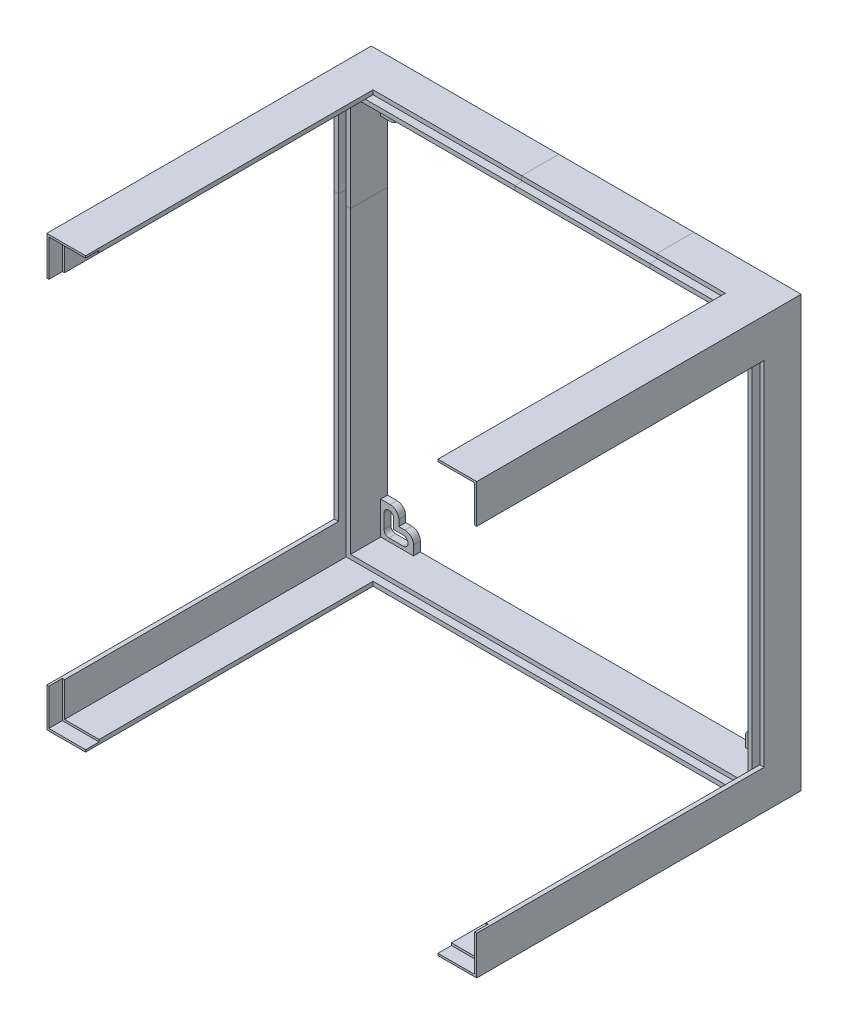
from build123d import *

# Parameters (mm, degrees)
BOSS_EXTRUDE3_DEPTH      = 6.35
BOSS_EXTRUDE3_2_DEPTH    = 6.35
BOSS_EXTRUDE3_3_DEPTH    = 6.35
BOSS_EXTRUDE3_4_DEPTH    = 6.35
BOSS_EXTRUDE10_DEPTH     = 5.08
SKETCH1_8_W              = 260.964039546
SKETCH1_8_H              = 3.175
SKETCH1_8_W_2            = 3.175
SKETCH1_8_H_2            = 260.964039546
BOSS_EXTRUDE4_DEPTH      = 27.44
BOSS_EXTRUDE6_DEPTH      = 240.35
SKETCH1_13_W             = 5.715
SKETCH1_13_H             = 260.964039546
SKETCH1_13_W_2           = 260.964039546
SKETCH1_13_H_2           = 5.715
BOSS_EXTRUDE9_DEPTH      = 6.35
CUT_EXTRUDE1_DEPTH       = 10
FILLET1_R                = 2.54
FILLET2_R                = 6.35
CIRPATTERN4_COUNT        = 4
FILLET2_OF_CIRPATTERN4_R = 6.35
SPLIT1_START             = 233.89375
SPLIT1_DEPTH             = 84.55875
SPLIT1_START_2           = 238.89375
SPLIT1_2_DEPTH           = 79.55875
SPLIT1_START_3           = 315.2775
SPLIT1_3_DEPTH           = 3.175
SPLIT1_START_4           = 223.99375
SPLIT1_4_OUTLINE_W       = 5.515
SPLIT1_4_OUTLINE_H       = 6.35
SPLIT1_4_OUTLINE_W_2     = 10
SPLIT1_4_DEPTH           = 85.56875
SPLIT1_5_DEPTH           = 230.35
SPLIT1_6_OUTLINE_W       = 3.175
SPLIT1_6_OUTLINE_H       = 50.814519773
SPLIT1_6_OUTLINE_W_2     = 110.149519773
SPLIT1_6_OUTLINE_H_2     = 3.175
SPLIT1_6_DEPTH           = 27.44
SPLIT1_7_DEPTH           = 6.35
SPLIT1_8_DEPTH           = 5.08
SPLIT1_START_5           = 230.35
SPLIT1_9_DEPTH           = 10
SPLIT1_START_6           = 138.89375
SPLIT1_10_DEPTH          = 85
SPLIT1_START_7           = 223.89375
SPLIT1_11_OUTLINE_W      = 3.175
SPLIT1_11_OUTLINE_H      = 27.44
SPLIT1_11_DEPTH          = 10
SPLIT1_START_8           = 133.89375
SPLIT1_12_DEPTH          = 5
SPLIT1_13_OUTLINE_W      = 3.175
SPLIT1_13_OUTLINE_H      = 27.44
SPLIT1_13_DEPTH          = 5
SPLIT1_START_9           = 123.99375
SPLIT1_14_OUTLINE_W      = 5.515
SPLIT1_14_OUTLINE_H      = 6.35
SPLIT1_14_DEPTH          = 9.9
SPLIT1_START_10          = 315.1775
SPLIT1_15_OUTLINE_W      = 15
SPLIT1_15_OUTLINE_H      = 6.35
SPLIT1_15_DEPTH          = 0.1
SPLIT1_START_11          = 309.5625
SPLIT1_16_OUTLINE_W      = 10
SPLIT1_16_OUTLINE_H      = 6.35
SPLIT1_16_DEPTH          = 0.1
SPLIT1_START_12          = 309.6625
SPLIT1_17_OUTLINE_W      = 0.1
SPLIT1_17_OUTLINE_H      = 6.35
SPLIT1_17_DEPTH          = 5.515


# Read off the part's stored shape, not the designer's step: Split1
with BuildPart() as part:
    # Sketch1 → Boss-Extrude3 (new body)
    with BuildSketch(Plane.XY):
        Polygon((3.175, 289.708269773), (8.89, 289.708269773), (8.89, 309.5625), (28.744230227, 309.5625), (28.744230227, 315.2775), (3.175, 315.2775), align=None)
    extrude(amount=BOSS_EXTRUDE3_DEPTH)


with BuildPart() as body_2:
    # Sketch1 → Boss-Extrude3 2 (new body)
    with BuildSketch(Plane.XY):
        Polygon((8.89, 8.89), (8.89, 28.744230227), (3.175, 28.744230227), (3.175, 3.175), (28.744230227, 3.175), (28.744230227, 8.89), align=None)
    extrude(amount=BOSS_EXTRUDE3_2_DEPTH)

    # Sketch1<8> → Boss-Extrude4 (add)
    with BuildSketch(Plane.XY):
        Polygon((28.744230227, 309.5625), (28.744230227, 306.3875), (36.364230227, 306.3875), (289.708269773, 306.3875), (289.708269773, 309.5625), align=None)
        Polygon((12.065, 282.088269773), (12.065, 289.708269773), (8.89, 289.708269773), (8.89, 28.744230227), (12.065, 28.744230227), align=None)
        with Locations((159.22625, 10.4775)):
            Rectangle(SKETCH1_8_W, SKETCH1_8_H)
        with Locations((307.975, 159.22625)):
            Rectangle(SKETCH1_8_W_2, SKETCH1_8_H_2)
        Polygon((8.89, 289.708269773), (12.065, 289.708269773), (12.065, 306.3875), (28.744230227, 306.3875), (28.744230227, 309.5625), (8.89, 309.5625), align=None)
        Polygon((289.708269773, 309.5625), (289.708269773, 306.3875), (306.3875, 306.3875), (306.3875, 289.708269773), (309.5625, 289.708269773), (309.5625, 309.5625), align=None)
        Polygon((306.3875, 12.065), (289.708269773, 12.065), (289.708269773, 8.89), (309.5625, 8.89), (309.5625, 28.744230227), (306.3875, 28.744230227), align=None)
        Polygon((12.065, 12.065), (12.065, 28.744230227), (8.89, 28.744230227), (8.89, 8.89), (28.744230227, 8.89), (28.744230227, 12.065), align=None)
        with Locations((1.5875, 159.22625)):
            Rectangle(SKETCH1_8_W_2, SKETCH1_8_H_2)
        with Locations((159.22625, 1.5875)):
            Rectangle(SKETCH1_8_W, SKETCH1_8_H)
        with Locations((316.865, 159.22625)):
            Rectangle(SKETCH1_8_W_2, SKETCH1_8_H_2)
        with Locations((159.22625, 316.865)):
            Rectangle(SKETCH1_8_W, SKETCH1_8_H)
    extrude(amount=BOSS_EXTRUDE4_DEPTH)


with BuildPart() as body_3:
    # Sketch1 → Boss-Extrude3 3 (new body)
    with BuildSketch(Plane.XY):
        Polygon((289.708269773, 315.2775), (289.708269773, 309.5625), (309.5625, 309.5625), (309.5625, 289.708269773), (315.2775, 289.708269773), (315.2775, 315.2775), align=None)
    extrude(amount=BOSS_EXTRUDE3_3_DEPTH)


with BuildPart() as body_4:
    # Sketch1 → Boss-Extrude3 4 (new body)
    with BuildSketch(Plane.XY):
        Polygon((309.5625, 8.89), (289.708269773, 8.89), (289.708269773, 3.175), (315.2775, 3.175), (315.2775, 28.744230227), (309.5625, 28.744230227), align=None)
    extrude(amount=BOSS_EXTRUDE3_4_DEPTH)



with BuildPart() as body_5:
    # Sketch1<14> → Boss-Extrude10 (new body)
    with BuildSketch(Plane.XY):
        Polygon((12.065, 306.3875), (12.065, 289.708269773), (12.065, 282.088269773), (25.4635, 282.088269773), (25.4635, 292.989), (36.364230227, 292.989), (36.364230227, 306.3875), (28.744230227, 306.3875), align=None)
        with BuildLine():
            ThreePointArc((14.5415, 300.355), (14.812184382, 301.715822285), (15.583028286, 302.869471714))
            ThreePointArc((15.583028286, 302.869471714), (16.736677715, 303.640315618), (18.0975, 303.911))
            Line((18.0975, 303.911), (28.744230227, 303.911))
            ThreePointArc((28.744230227, 303.911), (32.300230227, 300.355), (28.744230227, 296.799))
            Line((28.744230227, 296.799), (21.6535, 296.799))
            Line((21.6535, 296.799), (21.6535, 289.708269773))
            ThreePointArc((21.6535, 289.708269773), (18.0975, 286.152269773), (14.5415, 289.708269773))
            Line((14.5415, 289.708269773), (14.5415, 300.355))
        make_face(mode=Mode.SUBTRACT)
    boss_extrude10 = extrude(amount=BOSS_EXTRUDE10_DEPTH)


with BuildPart() as boss_extrude4_piece_1:
    # of the separate pieces the step leaves, piece 1, a body of its own (boss_extrude4_pieces)
    add(body_2.part.solids().sort_by_distance((8.89, 28.744230227, 0))[0])


with BuildPart() as boss_extrude4_piece_2:
    # of the separate pieces the step leaves, piece 2, a body of its own (boss_extrude4_pieces)
    add(body_2.part.solids().sort_by_distance((28.744230227, 318.4525, 0))[0])


with BuildPart() as boss_extrude4_piece_3:
    # of the separate pieces the step leaves, piece 3, a body of its own (boss_extrude4_pieces)
    add(body_2.part.solids().sort_by_distance((318.4525, 289.708269773, 0))[0])


with BuildPart() as boss_extrude4_piece_4:
    # of the separate pieces the step leaves, piece 4, a body of its own (boss_extrude4_pieces)
    add(body_2.part.solids().sort_by_distance((289.708269773, 3.175, 0))[0])


with BuildPart() as boss_extrude4_piece_5:
    # of the separate pieces the step leaves, piece 5, a body of its own (boss_extrude4_pieces)
    add(body_2.part.solids().sort_by_distance((3.175, 28.744230227, 27.44))[0])


with BuildPart() as body_4_1:
    add(body_4.part)

    add(boss_extrude4_piece_1.part)  # Boss-Extrude6 merges Boss-Extrude4 piece 1

    add(body_3.part)  # Boss-Extrude6 merges body 3

    add(part.part)  # Boss-Extrude6 merges part

    add(body_5.part)  # Boss-Extrude6 merges body 5

    add(boss_extrude4_piece_4.part)  # Boss-Extrude6 merges Boss-Extrude4 piece 4

    add(boss_extrude4_piece_5.part)  # Boss-Extrude6 merges Boss-Extrude4 piece 5

    add(boss_extrude4_piece_3.part)  # Boss-Extrude6 merges Boss-Extrude4 piece 3

    add(boss_extrude4_piece_2.part)  # Boss-Extrude6 merges Boss-Extrude4 piece 2
    # Sketch1<10> → Boss-Extrude6 (add)
    with BuildSketch(Plane.XY):
        Polygon((3.175, 3.175), (3.175, 28.744230227), (0, 28.744230227), (0, 0), (28.744230227, 0), (28.744230227, 3.175), align=None)
        Polygon((315.2775, 3.175), (289.708269773, 3.175), (289.708269773, 0), (318.4525, 0), (318.4525, 28.744230227), (315.2775, 28.744230227), align=None)
        Polygon((0, 289.708269773), (3.175, 289.708269773), (3.175, 315.2775), (28.744230227, 315.2775), (28.744230227, 318.4525), (0, 318.4525), align=None)
        Polygon((289.708269773, 318.4525), (289.708269773, 315.2775), (315.2775, 315.2775), (315.2775, 289.708269773), (318.4525, 289.708269773), (318.4525, 318.4525), align=None)
    extrude(amount=BOSS_EXTRUDE6_DEPTH)

    # Sketch1<13> → Boss-Extrude9 (add)
    with BuildSketch(Plane.XY):
        with Locations((6.0325, 159.22625)):
            Rectangle(SKETCH1_13_W, SKETCH1_13_H)
        with Locations((159.22625, 312.42)):
            Rectangle(SKETCH1_13_W_2, SKETCH1_13_H_2)
        with Locations((312.42, 159.22625)):
            Rectangle(SKETCH1_13_W, SKETCH1_13_H)
        with Locations((159.22625, 6.0325)):
            Rectangle(SKETCH1_13_W_2, SKETCH1_13_H_2)
    extrude(amount=BOSS_EXTRUDE9_DEPTH)

    # Sketch7 → Cut-Extrude1 (cut)
    with BuildSketch(Plane.XY.offset(240.35)):
        Polygon((28.744230227, 315.2775), (28.744230227, 316.9525), (1.5875, 316.9525), (1.5875, 289.708269773), (3.175, 289.708269773), (3.175, 315.2775), align=None)
    cut_extrude1 = extrude(amount=-CUT_EXTRUDE1_DEPTH, mode=Mode.SUBTRACT)

    # Fillet1
    fillet1_edges = [body_4_1.edges().sort_by_distance(p)[0] for p in [
        (25.4635, 292.989, 2.54),
        (21.6535, 296.799, 2.54),
    ]]
    fillet(fillet1_edges, radius=FILLET1_R)

    # Fillet2
    fillet2_edges = [body_4_1.edges().sort_by_distance(p)[0] for p in [
        (25.4635, 282.088269773, 2.54),
        (36.364230227, 292.989, 2.54),
    ]]
    fillet(fillet2_edges, radius=FILLET2_R)

    # CirPattern4: Boss-Extrude10, Cut-Extrude1 ×4 about axis
    cirpattern4_axis = Axis((159.22625, 159.22625, 0), (0, 0, 1))
    add([boss_extrude10.rotate(cirpattern4_axis, i * 360 / CIRPATTERN4_COUNT) for i in range(1, CIRPATTERN4_COUNT)])
    add([cut_extrude1.rotate(cirpattern4_axis, i * 360 / CIRPATTERN4_COUNT) for i in range(1, CIRPATTERN4_COUNT)], mode=Mode.SUBTRACT)

    # Fillet2 of CirPattern4
    fillet2_of_cirpattern4_edges = [body_4_1.edges().sort_by_distance(p)[0] for p in [
        (36.364230227, 25.4635, 2.54),
        (25.4635, 36.364230227, 2.54),
        (292.989, 36.364230227, 2.54),
        (282.088269773, 25.4635, 2.54),
        (282.088269773, 292.989, 2.54),
        (292.989, 282.088269773, 2.54),
    ]]
    fillet(fillet2_of_cirpattern4_edges, radius=FILLET2_OF_CIRPATTERN4_R)

    # Split1 outline → Split1 (cut)
    with BuildSketch(Plane(origin=(0, 0, 0), x_dir=(1, 0, 0), z_dir=(0, 1, 0)).offset(SPLIT1_START)):
        Polygon((3.275, 0), (3.275, -6.35), (3.175, -6.35), (3.175, -27.44), (0, -27.44), (0, -240.35), (28.744230227, -240.35), (28.744230227, -27.44), (233.89375, -27.44), (233.89375, -6.35), (223.89375, -6.35), (223.89375, 0), align=None)
    extrude(amount=SPLIT1_DEPTH, mode=Mode.SUBTRACT)

    # Split1 2 outline → Split1 2 (cut)
    with BuildSketch(Plane(origin=(0, 0, 0), x_dir=(1, 0, 0), z_dir=(0, 1, 0)).offset(SPLIT1_START_2)):
        Polygon((3.275, -6.35), (3.275, 0), (0, 0), (0, -27.44), (3.175, -27.44), (3.175, -6.35), align=None)
    extrude(amount=SPLIT1_2_DEPTH, mode=Mode.SUBTRACT)

    # Split1 3 outline → Split1 3 (cut)
    with BuildSketch(Plane(origin=(0, 0, 0), x_dir=(1, 0, 0), z_dir=(0, 1, 0)).offset(SPLIT1_START_3)):
        Polygon((223.89375, 0), (223.89375, -6.35), (233.89375, -6.35), (233.89375, -27.44), (238.89375, -27.44), (238.89375, 0), align=None)
    extrude(amount=SPLIT1_3_DEPTH, mode=Mode.SUBTRACT)

    # Split1 4 outline → Split1 4 (cut)
    with BuildSketch(Plane(origin=(0, 0, 0), x_dir=(1, 0, 0), z_dir=(0, 1, 0)).offset(SPLIT1_START_4)):
        with Locations((6.0325, -3.175)):
            Rectangle(SPLIT1_4_OUTLINE_W, SPLIT1_4_OUTLINE_H)
        with Locations((228.89375, -3.175)):
            Rectangle(SPLIT1_4_OUTLINE_W_2, SPLIT1_4_OUTLINE_H)
    extrude(amount=SPLIT1_4_DEPTH, mode=Mode.SUBTRACT)


with BuildPart() as body_2_2:
    # Split1 5 outline → Split1 5 (new body)
    with BuildSketch(Plane.XY):
        Polygon((3.175, 289.708269773), (3.175, 315.2775), (28.744230227, 315.2775), (28.744230227, 318.4525), (0, 318.4525), (0, 289.708269773), align=None)
    extrude(amount=SPLIT1_5_DEPTH)

    # Split1 6 outline → Split1 6 (add)
    with BuildSketch(Plane.XY):
        with Locations((1.5875, 264.301009887)):
            Rectangle(SPLIT1_6_OUTLINE_W, SPLIT1_6_OUTLINE_H)
        with Locations((83.818990114, 316.865)):
            Rectangle(SPLIT1_6_OUTLINE_W_2, SPLIT1_6_OUTLINE_H_2)
        Polygon((8.89, 309.5625), (8.89, 233.89375), (12.065, 233.89375), (12.065, 306.3875), (133.89375, 306.3875), (133.89375, 309.5625), align=None)
    extrude(amount=SPLIT1_6_DEPTH)

    # Split1 7 outline → Split1 7 (add)
    with BuildSketch(Plane.XY):
        Polygon((3.175, 238.89375), (3.275, 238.89375), (3.275, 223.99375), (8.79, 223.99375), (8.79, 233.89375), (8.89, 233.89375), (8.89, 309.5625), (123.89375, 309.5625), (123.89375, 315.2775), (3.175, 315.2775), align=None)
    extrude(amount=SPLIT1_7_DEPTH)

    # Split1 8 outline → Split1 8 (add)
    with BuildSketch(Plane.XY):
        with BuildLine():
            Line((12.065, 306.3875), (12.065, 282.088269773))
            Line((12.065, 282.088269773), (19.1135, 282.088269773))
            ThreePointArc((19.1135, 282.088269773), (23.603628061, 283.948141712), (25.4635, 288.438269773))
            Line((25.4635, 288.438269773), (25.4635, 290.449))
            ThreePointArc((25.4635, 290.449), (26.207448776, 292.245051224), (28.0035, 292.989))
            Line((28.0035, 292.989), (30.014230227, 292.989))
            ThreePointArc((30.014230227, 292.989), (34.504358288, 294.848871939), (36.364230227, 299.339))
            Line((36.364230227, 299.339), (36.364230227, 306.3875))
            Line((36.364230227, 306.3875), (12.065, 306.3875))
        make_face()
        with BuildLine():
            Line((21.6535, 294.259), (21.6535, 289.708269773))
            ThreePointArc((21.6535, 289.708269773), (18.0975, 286.152269773), (14.5415, 289.708269773))
            Line((14.5415, 289.708269773), (14.5415, 300.355))
            ThreePointArc((14.5415, 300.355), (15.583028286, 302.869471714), (18.0975, 303.911))
            Line((18.0975, 303.911), (28.744230227, 303.911))
            ThreePointArc((28.744230227, 303.911), (32.300230227, 300.355), (28.744230227, 296.799))
            Line((28.744230227, 296.799), (24.1935, 296.799))
            ThreePointArc((24.1935, 296.799), (22.397448776, 296.055051224), (21.6535, 294.259))
        make_face(mode=Mode.SUBTRACT)
    extrude(amount=SPLIT1_8_DEPTH)

    # Split1 9 outline → Split1 9 (add)
    with BuildSketch(Plane.XY.offset(SPLIT1_START_5)):
        Polygon((0, 318.4525), (0, 289.708269773), (1.5875, 289.708269773), (1.5875, 316.9525), (28.744230227, 316.9525), (28.744230227, 318.4525), align=None)
    extrude(amount=SPLIT1_9_DEPTH)


with BuildPart() as body_3_2:
    # Split1 10 outline → Split1 10 (new body)
    with BuildSketch(Plane.YZ.offset(SPLIT1_START_6)):
        Polygon((318.4525, 0), (318.4525, 27.44), (315.2775, 27.44), (315.2775, 6.35), (309.5625, 6.35), (309.5625, 27.44), (306.3875, 27.44), (306.3875, 0), align=None)
    extrude(amount=SPLIT1_10_DEPTH)

    # Split1 11 outline → Split1 11 (add)
    with BuildSketch(Plane.YZ.offset(SPLIT1_START_7)):
        with Locations((307.975, 13.72)):
            Rectangle(SPLIT1_11_OUTLINE_W, SPLIT1_11_OUTLINE_H)
        with Locations((316.865, 13.72)):
            Rectangle(SPLIT1_11_OUTLINE_W, SPLIT1_11_OUTLINE_H)
    extrude(amount=SPLIT1_11_DEPTH)

    # Split1 12 outline → Split1 12 (add)
    with BuildSketch(Plane.YZ.offset(SPLIT1_START_8)):
        Polygon((315.1775, 0), (315.1775, 6.35), (309.5625, 6.35), (309.5625, 27.44), (306.3875, 27.44), (306.3875, 0), align=None)
    extrude(amount=SPLIT1_12_DEPTH)

    # Split1 13 outline → Split1 13 (add)
    with BuildSketch(Plane.YZ.offset(SPLIT1_START)):
        with Locations((316.865, 13.72)):
            Rectangle(SPLIT1_13_OUTLINE_W, SPLIT1_13_OUTLINE_H)
    extrude(amount=SPLIT1_13_DEPTH)

    # Split1 14 outline → Split1 14 (add)
    with BuildSketch(Plane.YZ.offset(SPLIT1_START_9)):
        with Locations((312.42, 3.175)):
            Rectangle(SPLIT1_14_OUTLINE_W, SPLIT1_14_OUTLINE_H)
    extrude(amount=SPLIT1_14_DEPTH)


with BuildPart() as body_4_2:
    # Split1 15 outline → Split1 15 (new body)
    with BuildSketch(Plane(origin=(0, 0, 0), x_dir=(1, 0, 0), z_dir=(0, 1, 0)).offset(SPLIT1_START_10)):
        with Locations((131.39375, -3.175)):
            Rectangle(SPLIT1_15_OUTLINE_W, SPLIT1_15_OUTLINE_H)
    extrude(amount=SPLIT1_15_DEPTH)

    # Split1 16 outline → Split1 16 (add)
    with BuildSketch(Plane(origin=(0, 0, 0), x_dir=(1, 0, 0), z_dir=(0, 1, 0)).offset(SPLIT1_START_11)):
        with Locations((128.89375, -3.175)):
            Rectangle(SPLIT1_16_OUTLINE_W, SPLIT1_16_OUTLINE_H)
    extrude(amount=SPLIT1_16_DEPTH)

    # Split1 17 outline → Split1 17 (add)
    with BuildSketch(Plane(origin=(0, 0, 0), x_dir=(1, 0, 0), z_dir=(0, 1, 0)).offset(SPLIT1_START_12)):
        with Locations((123.94375, -3.175)):
            Rectangle(SPLIT1_17_OUTLINE_W, SPLIT1_17_OUTLINE_H)
    extrude(amount=SPLIT1_17_DEPTH)


solid = Compound([body_4_1.part, body_2_2.part, body_3_2.part, body_4_2.part])
